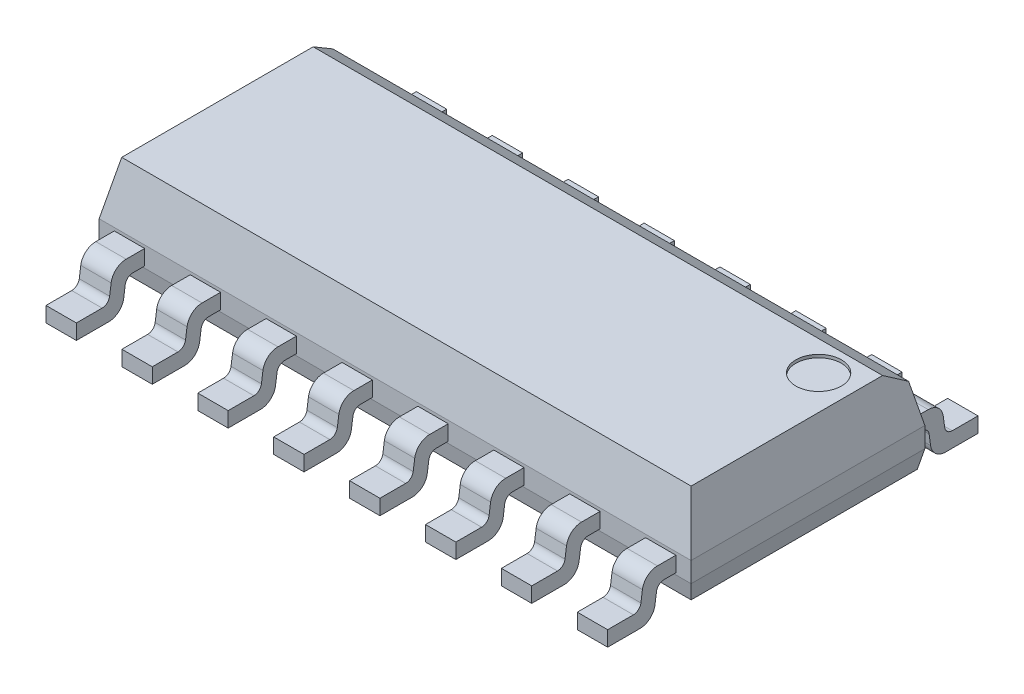
from build123d import *
from OCP.BRepFilletAPI import BRepFilletAPI_MakeChamfer

# Parameters (mm, degrees)
PIN_1_LEADFRAME_DEPTH   = 0.508
OUTSIDE_RADII_R         = 0.254
INSIDE_RADII_R          = 0.127
SKETCH2_W               = 9.906
SKETCH2_H               = 3.9116
BODY_DEPTH              = 1.524
PINS_COUNT              = 8
PINS_PITCH              = 1.27
OUTSIDE_RADII_OF_PINS_R = 0.254
INSIDE_RADII_OF_PINS_R  = 0.127
BOTTOM_CHAMFER_SIZE     = 0.0635
BOTTOM_CHAMFER_SIZE2    = 0.298744012
TOP_CHAMFER_SIZE        = 0.889
TOP_CHAMFER_SIZE2       = 0.188962783
PIN_1_CHAMFER_SIZE      = 0.254
PIN_1_CHAMFER_SIZE2     = 0.329769096
SKETCH3_R               = 0.381
PIN_1_MARK_DEPTH        = 0.0508


with BuildPart() as part:
    # Sketch1 → Pin 1 Leadframe (new body)
    with BuildSketch(Plane(origin=(-0.254, 0, 0), x_dir=(0, 0, -1), z_dir=(1, 0, 0))):
        Polygon((2.265405256, 0.508), (-2.265405256, 0.508), (-2.3368, 0), (-3.0988, 0), (-3.0988, 0.254), (-2.557598831, 0.254), (-2.486204087, 0.762), (2.486204087, 0.762), (2.557598831, 0.254), (3.0988, 0.254), (3.0988, 0), (2.3368, 0), align=None)
    pin_1_leadframe = extrude(amount=PIN_1_LEADFRAME_DEPTH)

    # Outside Radii
    outside_radii_edges = [part.edges().sort_by_distance(p)[0] for p in [
        (0, 0, -2.3368),
        (0, 0.762, -2.486204087),
        (0, 0, 2.3368),
        (0, 0.762, 2.486204087),
    ]]
    fillet(outside_radii_edges, radius=OUTSIDE_RADII_R)

    # Inside Radii
    inside_radii_edges = [part.edges().sort_by_distance(p)[0] for p in [
        (0, 0.254, -2.557598831),
        (0, 0.508, -2.265405256),
        (0, 0.508, 2.265405256),
        (0, 0.254, 2.557598831),
    ]]
    fillet(inside_radii_edges, radius=INSIDE_RADII_R)

    # Sketch2 → Body (add)
    with BuildSketch(Plane(origin=(0, 0.1778, 0), x_dir=(1, 0, 0), z_dir=(0, 1, 0))):
        with Locations((-4.445, 0)):
            Rectangle(SKETCH2_W, SKETCH2_H)
    extrude(amount=BODY_DEPTH)

    # Pins: Pin 1 Leadframe ×8
    with Locations(*[(-i * PINS_PITCH, 0, 0) for i in range(1, PINS_COUNT)]):
        add(pin_1_leadframe)

    # Outside Radii of Pins
    outside_radii_of_pins_edges = [part.edges().sort_by_distance(p)[0] for p in [
        (-1.27, 0, -2.3368),
        (-1.27, 0.762, -2.486204087),
        (-1.27, 0, 2.3368),
        (-1.27, 0.762, 2.486204087),
        (-2.54, 0, -2.3368),
        (-2.54, 0.762, -2.486204087),
        (-2.54, 0, 2.3368),
        (-2.54, 0.762, 2.486204087),
        (-3.81, 0, -2.3368),
        (-3.81, 0.762, -2.486204087),
        (-3.81, 0, 2.3368),
        (-3.81, 0.762, 2.486204087),
        (-5.08, 0, -2.3368),
        (-5.08, 0.762, -2.486204087),
        (-5.08, 0, 2.3368),
        (-5.08, 0.762, 2.486204087),
        (-6.35, 0, -2.3368),
        (-6.35, 0.762, -2.486204087),
        (-6.35, 0, 2.3368),
        (-6.35, 0.762, 2.486204087),
        (-7.62, 0, -2.3368),
        (-7.62, 0.762, -2.486204087),
        (-7.62, 0, 2.3368),
        (-7.62, 0.762, 2.486204087),
        (-8.89, 0, -2.3368),
        (-8.89, 0.762, -2.486204087),
        (-8.89, 0, 2.3368),
        (-8.89, 0.762, 2.486204087),
    ]]
    fillet(outside_radii_of_pins_edges, radius=OUTSIDE_RADII_OF_PINS_R)

    # Inside Radii of Pins
    inside_radii_of_pins_edges = [part.edges().sort_by_distance(p)[0] for p in [
        (-1.27, 0.254, -2.557598831),
        (-1.27, 0.508, -2.265405256),
        (-1.27, 0.508, 2.265405256),
        (-1.27, 0.254, 2.557598831),
        (-2.54, 0.254, -2.557598831),
        (-2.54, 0.508, -2.265405256),
        (-2.54, 0.508, 2.265405256),
        (-2.54, 0.254, 2.557598831),
        (-3.81, 0.254, -2.557598831),
        (-3.81, 0.508, -2.265405256),
        (-3.81, 0.508, 2.265405256),
        (-3.81, 0.254, 2.557598831),
        (-5.08, 0.254, -2.557598831),
        (-5.08, 0.508, -2.265405256),
        (-5.08, 0.508, 2.265405256),
        (-5.08, 0.254, 2.557598831),
        (-6.35, 0.254, -2.557598831),
        (-6.35, 0.508, -2.265405256),
        (-6.35, 0.508, 2.265405256),
        (-6.35, 0.254, 2.557598831),
        (-7.62, 0.254, -2.557598831),
        (-7.62, 0.508, -2.265405256),
        (-7.62, 0.508, 2.265405256),
        (-7.62, 0.254, 2.557598831),
        (-8.89, 0.254, -2.557598831),
        (-8.89, 0.508, -2.265405256),
        (-8.89, 0.508, 2.265405256),
        (-8.89, 0.254, 2.557598831),
    ]]
    fillet(inside_radii_of_pins_edges, radius=INSIDE_RADII_OF_PINS_R)

    # Bottom Chamfer
    bottom_chamfer_edges = [part.edges().sort_by_distance(p)[0] for p in [
        (-4.445, 0.1778, 1.9558),
        (-9.398, 0.1778, 0),
        (-4.445, 0.1778, -1.9558),
        (0.508, 0.1778, 0),
    ]]
    bottom_chamfer_side = [part.faces().sort_by_distance(p)[0] for p in [
        (-4.445, 0.1778, 0),
    ]]
    chamfer(bottom_chamfer_edges, length=BOTTOM_CHAMFER_SIZE, length2=BOTTOM_CHAMFER_SIZE2, reference=bottom_chamfer_side[0])

    # Top Chamfer: one chamfer whose edges measure the first distance from different faces: ONE call of the kernel's chamfer builder (chamfer() names one face for all edges)
    top_chamfer_edges_1 = [part.edges().sort_by_distance(p)[0] for p in [
        (0.508, 1.7018, 0),
    ]]
    top_chamfer_side_1 = [part.faces().sort_by_distance(p)[0] for p in [
        (0.508, 1.089172006, 0),
    ]]
    top_chamfer_edges_2 = [part.edges().sort_by_distance(p)[0] for p in [
        (-4.445, 1.7018, -1.9558),
    ]]
    top_chamfer_side_2 = [part.faces().sort_by_distance(p)[0] for p in [
        (-4.445, 1.131388692, -1.9558),
    ]]
    top_chamfer_edges_3 = [part.edges().sort_by_distance(p)[0] for p in [
        (-4.445, 1.7018, 1.9558),
    ]]
    top_chamfer_side_3 = [part.faces().sort_by_distance(p)[0] for p in [
        (-4.445, 1.131388692, 1.9558),
    ]]
    top_chamfer_edges_4 = [part.edges().sort_by_distance(p)[0] for p in [
        (-9.398, 1.7018, 0),
    ]]
    top_chamfer_side_4 = [part.faces().sort_by_distance(p)[0] for p in [
        (-9.398, 1.089172006, 0),
    ]]
    top_chamfer = BRepFilletAPI_MakeChamfer(part.part.solid().wrapped)
    for e in top_chamfer_edges_1:
        top_chamfer.Add(TOP_CHAMFER_SIZE, TOP_CHAMFER_SIZE2, e.wrapped, top_chamfer_side_1[0].wrapped)  # the first distance lies on this face
    for e in top_chamfer_edges_2:
        top_chamfer.Add(TOP_CHAMFER_SIZE, TOP_CHAMFER_SIZE2, e.wrapped, top_chamfer_side_2[0].wrapped)  # the first distance lies on this face
    for e in top_chamfer_edges_3:
        top_chamfer.Add(TOP_CHAMFER_SIZE, TOP_CHAMFER_SIZE2, e.wrapped, top_chamfer_side_3[0].wrapped)  # the first distance lies on this face
    for e in top_chamfer_edges_4:
        top_chamfer.Add(TOP_CHAMFER_SIZE, TOP_CHAMFER_SIZE2, e.wrapped, top_chamfer_side_4[0].wrapped)  # the first distance lies on this face
    add(Compound.cast(top_chamfer.Shape()), mode=Mode.REPLACE)

    # Pin 1 Chamfer
    pin_1_chamfer_edges = [part.edges().sort_by_distance(p)[0] for p in [
        (-4.445, 1.7018, -1.766837217),
    ]]
    pin_1_chamfer_side = [part.faces().sort_by_distance(p)[0] for p in [
        (-4.445, 1.254418671, -1.861931054),
    ]]
    chamfer(pin_1_chamfer_edges, length=PIN_1_CHAMFER_SIZE, length2=PIN_1_CHAMFER_SIZE2, reference=pin_1_chamfer_side[0])

    # Sketch3 → Pin 1 Mark (cut)
    with BuildSketch(Plane(origin=(0, 1.7018, 0), x_dir=(1, 0, 0), z_dir=(0, 1, 0))):
        with Locations((-0.254, 0.9398)):
            Circle(SKETCH3_R)
    extrude(amount=-PIN_1_MARK_DEPTH, mode=Mode.SUBTRACT)


solid = part.part
